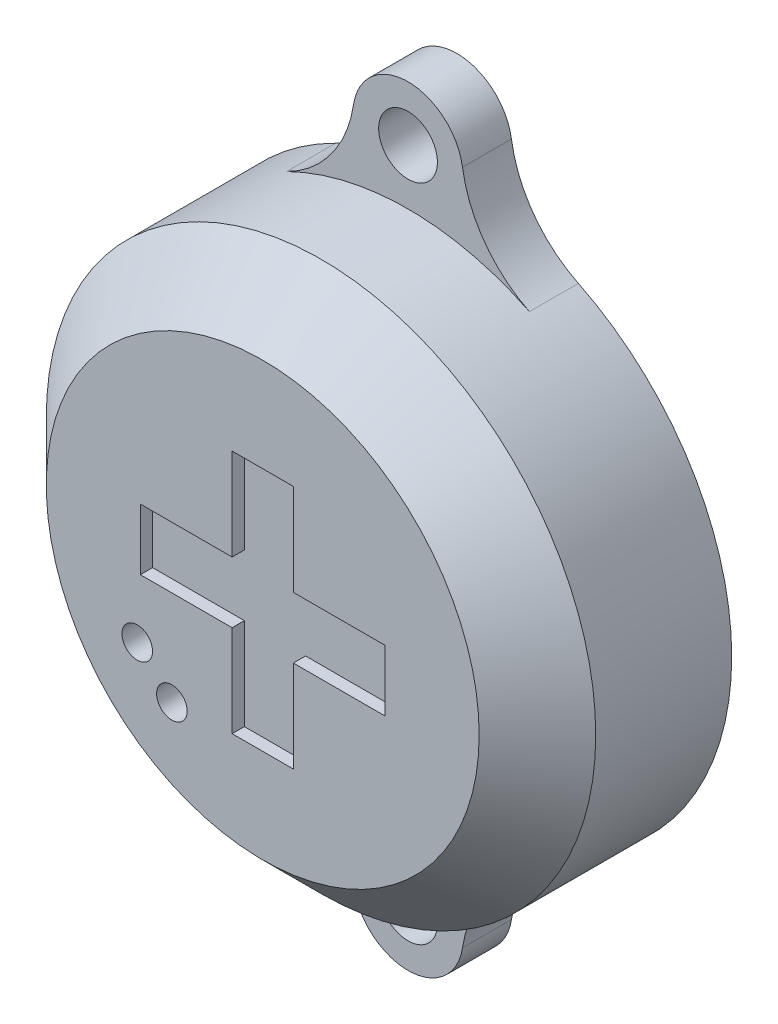
from build123d import *
from build123d.topology import SkipClean

# Parameters (mm, degrees)
SKETCH1_R           = 2.4
BOSS_EXTRUDE1_DEPTH = 15.875
CUT_EXTRUDE11_START = -11.875
SKETCH13_R          = 2.4
CUT_EXTRUDE11_DEPTH = 11.875
CHAMFER1_SIZE       = 4.7625
SHELL1_OUTLINE_R    = 20.45
SHELL1_DEPTH        = 10.284072775
SHELL1_2_DEPTH      = 2
BOSS_EXTRUDE2_START = 2
BOSS_EXTRUDE2_DEPTH = 2
SKETCH15_W          = 7.5
SKETCH15_H          = 5
SKETCH15_W_2        = 5
SKETCH15_H_2        = 7.5
CUT_EXTRUDE12_DEPTH = 1
SKETCH16_R          = 1.25
CUT_EXTRUDE13_DEPTH = 42.774640932


with BuildPart() as part:
    # Sketch1 → Boss-Extrude1 (new body)
    # profile 1 of 3: a face of its own
    with BuildSketch(Plane.XY):
        with BuildLine():
            ThreePointArc((9.919608253, -20.139609532), (13.072195817, -18.251580659), (15.874547238, -15.874547238))
            Line((15.874547238, -15.874547238), (14.460333675, -14.460333675))
            ThreePointArc((14.460333675, -14.460333675), (-14.460333675, -14.460333675), (-14.460333675, 14.460333675))
            Line((-14.460333675, 14.460333675), (-15.874547238, 15.874547238))
            ThreePointArc((-15.874547238, 15.874547238), (-22.149254758, -3.662378144), (-9.919608253, -20.139609532))
            ThreePointArc((-9.919608253, -20.139609532), (-6.265793461, -23.208178662), (-4.449768206, -27.62049453))
            ThreePointArc((-4.449768206, -27.62049453), (0, -31.45), (4.449768206, -27.62049453))
            ThreePointArc((4.449768206, -27.62049453), (6.265793461, -23.208178662), (9.919608253, -20.139609532))
        make_face()
        with Locations((0, -26.95)):
            Circle(SKETCH1_R, mode=Mode.SUBTRACT)
    # profile 2 of 3: a face of its own
    with BuildSketch(Plane.XY):
        with BuildLine():
            Line((14.460333675, -14.460333675), (15.874547238, -15.874547238))
            ThreePointArc((15.874547238, -15.874547238), (22.149254758, 3.662378144), (9.919608253, 20.139609532))
            ThreePointArc((9.919608253, 20.139609532), (6.265793461, 23.208178662), (4.449768206, 27.62049453))
            ThreePointArc((4.449768206, 27.62049453), (0, 31.45), (-4.449768206, 27.62049453))
            ThreePointArc((-4.449768206, 27.62049453), (-6.265793461, 23.208178662), (-9.919608253, 20.139609532))
            ThreePointArc((-9.919608253, 20.139609532), (-13.072195817, 18.251580659), (-15.874547238, 15.874547238))
            Line((-15.874547238, 15.874547238), (-14.460333675, 14.460333675))
            ThreePointArc((-14.460333675, 14.460333675), (14.460333675, 14.460333675), (14.460333675, -14.460333675))
        make_face()
        with Locations((0, 26.95)):
            Circle(SKETCH1_R, mode=Mode.SUBTRACT)
    # profile 3 of 3: a face of its own
    with BuildSketch(Plane.XY):
        with BuildLine():
            ThreePointArc((-14.460333675, 14.460333675), (-14.460333675, -14.460333675), (14.460333675, -14.460333675))
            ThreePointArc((14.460333675, -14.460333675), (14.460333675, 14.460333675), (-14.460333675, 14.460333675))
        make_face()
    extrude(amount=BOSS_EXTRUDE1_DEPTH)

    # Sketch13 → Cut-Extrude11 (cut)
    # profile 1 of 2: a face of its own
    with SkipClean():  # the faces are left unmerged after this step: merging them gives an invalid solid
        with BuildSketch(Plane.XY.offset(15.875).offset(CUT_EXTRUDE11_START)):
            with BuildLine():
                ThreePointArc((4.449768206, -27.62049453), (6.265793461, -23.208178662), (9.919608253, -20.139609532))
                ThreePointArc((9.919608253, -20.139609532), (0, -22.45), (-9.919608253, -20.139609532))
                ThreePointArc((-9.919608253, -20.139609532), (-6.265793461, -23.208178662), (-4.449768206, -27.62049453))
                ThreePointArc((-4.449768206, -27.62049453), (0, -31.45), (4.449768206, -27.62049453))
            make_face()
            with Locations((0, -26.95)):
                Circle(SKETCH13_R, mode=Mode.SUBTRACT)
        # profile 2 of 2: a face of its own
        with BuildSketch(Plane.XY.offset(15.875).offset(CUT_EXTRUDE11_START)):
            with BuildLine():
                ThreePointArc((-9.919608253, 20.139609532), (0, 22.45), (9.919608253, 20.139609532))
                ThreePointArc((9.919608253, 20.139609532), (6.265793461, 23.208178662), (4.449768206, 27.62049453))
                ThreePointArc((4.449768206, 27.62049453), (0, 31.45), (-4.449768206, 27.62049453))
                ThreePointArc((-4.449768206, 27.62049453), (-6.265793461, 23.208178662), (-9.919608253, 20.139609532))
            make_face()
            with Locations((0, 26.95)):
                Circle(SKETCH13_R, mode=Mode.SUBTRACT)
        extrude(amount=CUT_EXTRUDE11_DEPTH, mode=Mode.SUBTRACT)

    # Chamfer1
    chamfer1_edges = [part.edges().sort_by_distance(p)[0] for p in [
        (22.45, 0, 15.875),
    ]]
    chamfer(chamfer1_edges, length=CHAMFER1_SIZE)

    # Shell1: read off the stored shape, not the designer's step
    # Shell1 outline → Shell1 (cut)
    with SkipClean():  # the faces are left unmerged after this step: merging them gives an invalid solid
        with BuildSketch(Plane.XY):
            Circle(SHELL1_OUTLINE_R)
        extrude(amount=SHELL1_DEPTH, mode=Mode.SUBTRACT)

    # Shell1 2 outline → Shell1 2 (cut)
    with SkipClean():  # the faces are left unmerged after this step: merging them gives an invalid solid
        with BuildSketch(Plane.XY):
            with BuildLine():
                ThreePointArc((-3.405256243, -24.163563222), (0, -22.55), (3.405256243, -24.163563222))
                ThreePointArc((3.405256243, -24.163563222), (5.715063361, -20.765273279), (9.035901505, -18.345434963))
                ThreePointArc((9.035901505, -18.345434963), (0, -20.45), (-9.035901505, -18.345434963))
                ThreePointArc((-9.035901505, -18.345434963), (-5.715063361, -20.765273279), (-3.405256243, -24.163563222))
            make_face()
            with BuildLine():
                ThreePointArc((-3.405256243, 24.163563222), (-5.715063361, 20.765273279), (-9.035901505, 18.345434963))
                ThreePointArc((-9.035901505, 18.345434963), (0, 20.45), (9.035901505, 18.345434963))
                ThreePointArc((9.035901505, 18.345434963), (5.715063361, 20.765273279), (3.405256243, 24.163563222))
                ThreePointArc((3.405256243, 24.163563222), (0, 22.55), (-3.405256243, 24.163563222))
            make_face()
        extrude(amount=SHELL1_2_DEPTH, mode=Mode.SUBTRACT)

    # Shell1 3 outline → Shell1 3 (revolve, cut)
    with SkipClean():  # the faces are left unmerged after this step: merging them gives an invalid solid
        with BuildSketch(Plane.XZ):
            Polygon((16.859072875, 13.875), (0, 13.875), (0, 10.284072775), (20.45, 10.284072775), align=None)
        revolve(axis=Axis((0, 0, 0), (0, 0, 1)), mode=Mode.SUBTRACT)

    # Sketch14 → Boss-Extrude2 (add)
    with SkipClean():  # the faces are left unmerged after this step: merging them gives an invalid solid
        with BuildSketch(Plane(origin=(0, 0, 2), x_dir=(-1, 0, 0), z_dir=(0, 0, -1)).offset(BOSS_EXTRUDE2_START)):
            with BuildLine():
                ThreePointArc((-9.035901505, 18.345434963), (-5.715063361, 20.765273279), (-3.405256243, 24.163563222))
                ThreePointArc((-3.405256243, 24.163563222), (0, 22.55), (3.405256243, 24.163563222))
                ThreePointArc((3.405256243, 24.163563222), (5.715063361, 20.765273279), (9.035901505, 18.345434963))
                ThreePointArc((9.035901505, 18.345434963), (0, 20.45), (-9.035901505, 18.345434963))
            make_face()
            with BuildLine():
                ThreePointArc((9.035901505, -18.345434963), (5.715063361, -20.765273279), (3.405256243, -24.163563222))
                ThreePointArc((3.405256243, -24.163563222), (0, -22.55), (-3.405256243, -24.163563222))
                ThreePointArc((-3.405256243, -24.163563222), (-5.715063361, -20.765273279), (-9.035901505, -18.345434963))
                ThreePointArc((-9.035901505, -18.345434963), (0, -20.45), (9.035901505, -18.345434963))
            make_face()
        extrude(amount=-BOSS_EXTRUDE2_DEPTH)

    # Sketch15 → Cut-Extrude12 (cut)
    with SkipClean():  # the faces are left unmerged after this step: merging them gives an invalid solid
        with BuildSketch(Plane.XY.offset(15.875)):
            with Locations((-6.25, 0)):
                Rectangle(SKETCH15_W, SKETCH15_H)
            Rectangle(SKETCH15_W_2, SKETCH15_H)
            with Locations((6.25, 0)):
                Rectangle(SKETCH15_W, SKETCH15_H)
            with Locations((0, -6.25)):
                Rectangle(SKETCH15_W_2, SKETCH15_H_2)
            with Locations((0, 6.25)):
                Rectangle(SKETCH15_W_2, SKETCH15_H_2)
        extrude(amount=-CUT_EXTRUDE12_DEPTH, mode=Mode.SUBTRACT)

    # Sketch16 → Cut-Extrude13 (cut, through all)
    with SkipClean():  # the faces are left unmerged after this step: merging them gives an invalid solid
        with BuildSketch(Plane.XY.offset(15.875)):
            with Locations((-7.424621202, -10.253048327)):
                Circle(SKETCH16_R)
            with Locations((-10.253048327, -7.424621202)):
                Circle(SKETCH16_R)
        extrude(amount=-CUT_EXTRUDE13_DEPTH, mode=Mode.SUBTRACT)


solid = part.part
